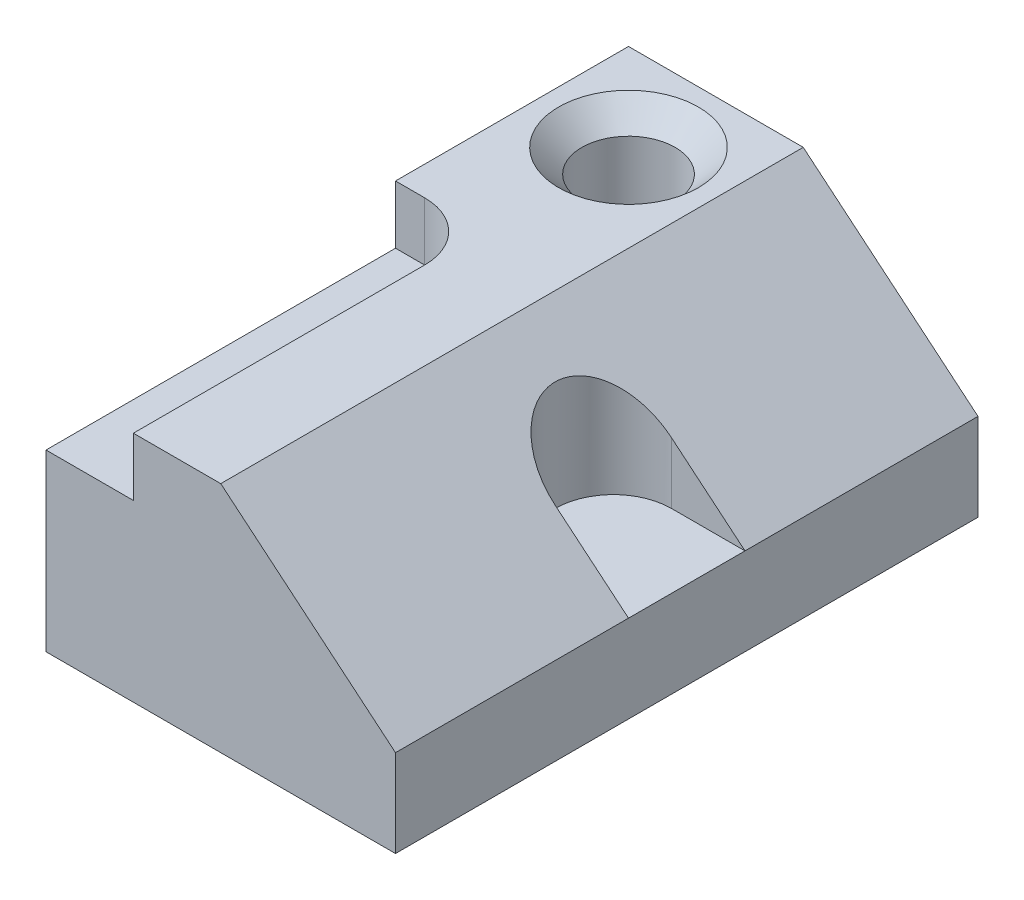
from build123d import *

# Parameters (mm, degrees)
BOSS_EXTRUDE1_DEPTH    = 127
CUT_EXTRUDE3_OUTLINE_R = 10.16
CUT_EXTRUDE3_DEPTH     = 50.8
CHAMFER3_SIZE          = 5.08
SKETCH2_W              = 19.05
SKETCH2_H              = 76.2
CUT_EXTRUDE4_DEPTH     = 12.7
FILLET2_R              = 12.7
CUT_EXTRUDE10_DEPTH    = 31.75


# Read off the part's stored shape, not the designer's step: Cut-Extrude3
with BuildPart() as part:
    # Sketch1 → Boss-Extrude1 (new body)
    with BuildSketch(Plane.XY):
        Polygon((0, 0), (76.2, 0), (76.2, 19.05), (38.1, 50.8), (0, 50.8), align=None)
    extrude(amount=BOSS_EXTRUDE1_DEPTH)

    # Cut-Extrude3 outline → Cut-Extrude3 (cut)
    with BuildSketch(Plane(origin=(0, 0, 0), x_dir=(1, 0, 0), z_dir=(0, 1, 0))):
        with Locations((19.05, -19.05)):
            Circle(CUT_EXTRUDE3_OUTLINE_R)
    extrude(amount=CUT_EXTRUDE3_DEPTH, mode=Mode.SUBTRACT)

    # Chamfer3
    chamfer3_edges = [part.edges().sort_by_distance(p)[0] for p in [
        (8.89, 50.8, 19.05),
        (8.89, 0, 19.05),
    ]]
    chamfer(chamfer3_edges, length=CHAMFER3_SIZE)

    # Sketch2 → Cut-Extrude4 (cut)
    with BuildSketch(Plane(origin=(0, 50.8, 0), x_dir=(1, 0, 0), z_dir=(0, 1, 0))):
        with Locations((9.525, -88.9)):
            Rectangle(SKETCH2_W, SKETCH2_H)
    extrude(amount=-CUT_EXTRUDE4_DEPTH, mode=Mode.SUBTRACT)

    # Fillet2
    fillet2_edges = [part.edges().sort_by_distance(p)[0] for p in [
        (19.05, 44.45, 50.8),
    ]]
    fillet(fillet2_edges, radius=FILLET2_R)

    # Sketch3 → Cut-Extrude10 (cut)
    with BuildSketch(Plane(origin=(0, 50.8, 0), x_dir=(1, 0, 0), z_dir=(0, 1, 0))):
        with BuildLine():
            Line((76.2, -50.8), (60.198, -50.8))
            ThreePointArc((60.198, -50.8), (47.498, -63.5), (60.198, -76.2))
            Line((60.198, -76.2), (76.2, -76.2))
            Line((76.2, -76.2), (76.2, -50.8))
        make_face()
    extrude(amount=-CUT_EXTRUDE10_DEPTH, mode=Mode.SUBTRACT)


solid = part.part
